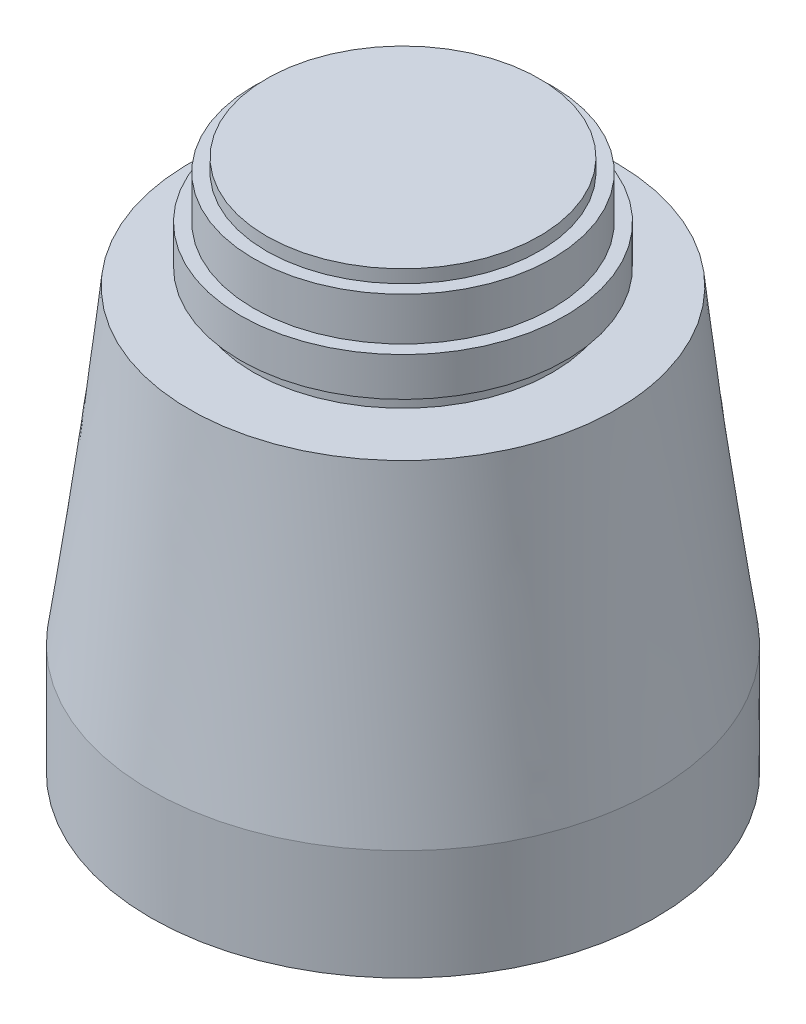
from build123d import *
from build123d.topology import SkipClean

# Parameters (mm, degrees)
SKETCH1_R           = 19.5
BOSS_EXTRUDE1_DEPTH = 32.53
SKETCH2_R           = 11.55
BOSS_EXTRUDE2_DEPTH = 8.63
BOSS_EXTRUDE3_START = -4.33
SKETCH3_R           = 12.55
BOSS_EXTRUDE3_DEPTH = 3
CUT_EXTRUDE1_START  = -1
SKETCH4_R           = 11.55
SKETCH4_R_2         = 10.55
CUT_EXTRUDE1_DEPTH  = 1
CUT_EXTRUDE3_START  = -24
SKETCH5_R           = 19.5
SKETCH5_R_2         = 16.5
CUT_EXTRUDE3_DEPTH  = 24


with BuildPart() as part:
    # Sketch1 → Boss-Extrude1 (new body)
    with BuildSketch(Plane(origin=(0, 0, 0), x_dir=(1, 0, 0), z_dir=(0, 1, 0))):
        with Locations(Location((0, 0, 0), (0, 0, 270))):
            Circle(SKETCH1_R)
    extrude(amount=BOSS_EXTRUDE1_DEPTH)

    # Sketch2 → Boss-Extrude2 (add)
    with BuildSketch(Plane(origin=(0, 32.53, 0), x_dir=(1, 0, 0), z_dir=(0, 1, 0))):
        with Locations(Location((0, 0, 0), (0, 0, 270))):
            Circle(SKETCH2_R)
    extrude(amount=BOSS_EXTRUDE2_DEPTH)

    # Sketch3 → Boss-Extrude3 (add)
    with BuildSketch(Plane(origin=(0, 41.16, 0), x_dir=(1, 0, 0), z_dir=(0, 1, 0)).offset(BOSS_EXTRUDE3_START)):
        with Locations(Location((0, 0, 0), (0, 0, 270))):
            Circle(SKETCH3_R)
    extrude(amount=-BOSS_EXTRUDE3_DEPTH)

    # Sketch4 → Cut-Extrude1 (cut)
    with BuildSketch(Plane(origin=(0, 41.16, 0), x_dir=(1, 0, 0), z_dir=(0, 1, 0)).offset(CUT_EXTRUDE1_START)):
        with Locations(Location((0, 0, 0), (0, 0, 270))):
            Circle(SKETCH4_R)
        with Locations(Location((0, 0, 0), (0, 0, 270))):
            Circle(SKETCH4_R_2, mode=Mode.SUBTRACT)
    extrude(amount=CUT_EXTRUDE1_DEPTH, mode=Mode.SUBTRACT)

    # Sketch5 → Cut-Extrude3 (cut)
    with BuildSketch(Plane(origin=(0, 32.53, 0), x_dir=(1, 0, 0), z_dir=(0, 1, 0)).offset(CUT_EXTRUDE3_START)):
        with Locations(Location((0, 0, 0), (0, 0, 270))):
            Circle(SKETCH5_R)
        with Locations(Location((0, 0, 0), (0, 0, 270))):
            Circle(SKETCH5_R_2, mode=Mode.SUBTRACT)
    extrude(amount=CUT_EXTRUDE3_DEPTH, mode=Mode.SUBTRACT)

    # Loft1: read off the stored shape, not the designer's step
    # Loft1: loft between two sections, ruled curve by curve
    with SkipClean():  # the faces are left unmerged after this step: merging them gives an invalid solid
        loft1_from = [
            Edge.make_bspline([(-19.27501261, 8.53, 2.953623009), (-13.367766593, 8.53, 41.503648229), (25.182258628, 8.53, 35.596402212), (19.27501261, 8.53, -2.953623009), (13.367766593, 8.53, -41.503648229), (-25.182258628, 8.53, -35.596402212), (-19.27501261, 8.53, 2.953623009)], [0, 0, 0, 0, 0.5, 0.5, 0.5, 1, 1, 1, 1], 3, [1, 0.333333333, 0.333333333, 1, 0.333333333, 0.333333333, 1]),
        ]
        loft1_to = [
            Edge.make_bspline([(-16.450749829, 32.53, -1.273903469), (-18.998556767, 32.53, 31.62759619), (13.902942892, 32.53, 34.175403128), (16.450749829, 32.53, 1.273903469), (18.998556767, 32.53, -31.62759619), (-13.902942892, 32.53, -34.175403128), (-16.450749829, 32.53, -1.273903469)], [0, 0, 0, 0, 0.5, 0.5, 0.5, 1, 1, 1, 1], 3, [1, 0.333333333, 0.333333333, 1, 0.333333333, 0.333333333, 1]),
        ]
        loft1 = Solid(Shell([*[Face.make_surface_from_curves(loft1_from[k], loft1_to[k]) for k in range(1)], Face(Wire(loft1_from)), Face(Wire(loft1_to))]))
        add(loft1)


solid = part.part
